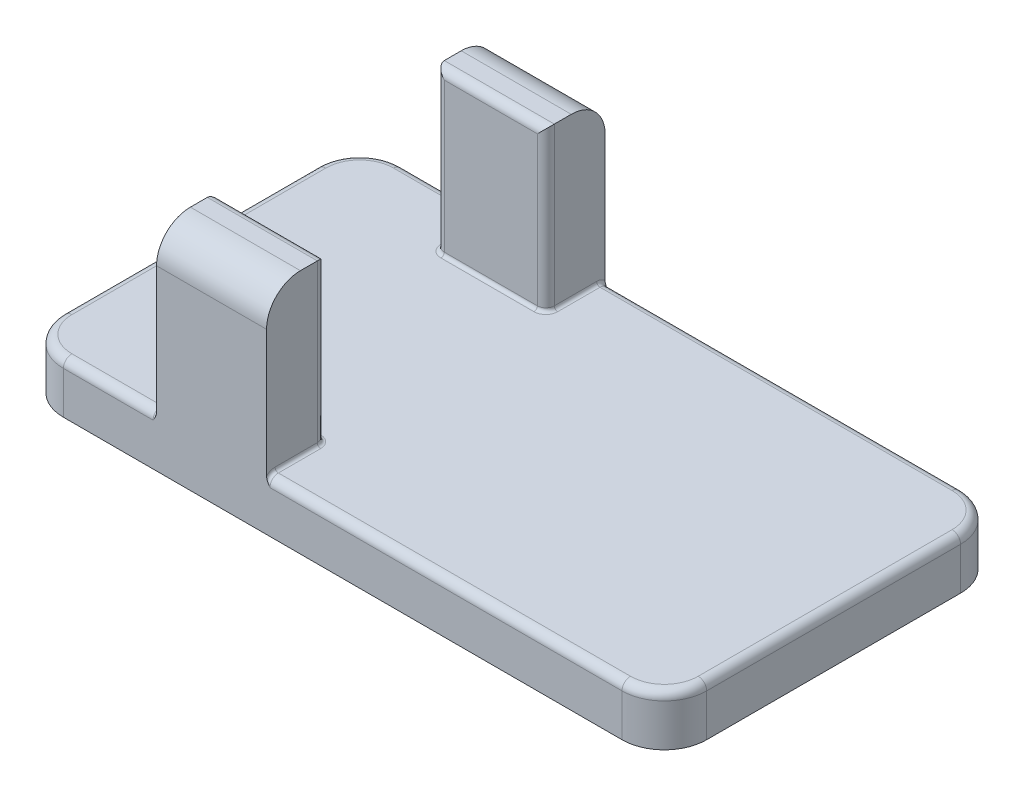
from build123d import *

# Parameters (mm, degrees)
SKETCH_1_W          = 76
SKETCH_1_H          = 40
EXTRUDE_1_DEPTH     = 6
SKETCH_2_W          = 13
SKETCH_2_H          = 40
EXTRUDE_2_DEPTH     = 19
SKETCH_3_W          = 13
SKETCH_3_H          = 26
CUT_EXTRUDE_1_DEPTH = 19
FILLET_1_R          = 4
FILLET_2_R          = 1
FILLET_3_R          = 1
FILLET_4_R          = 5
FILLET_5_R          = 1
FILLET_6_R          = 1
FILLET_7_R          = 0.4


with BuildPart() as part:
    # Эскиз1 → Бобышка-Вытянуть1 (new body)
    with BuildSketch(Plane(origin=(0, 0, 0), x_dir=(1, 0, 0), z_dir=(0, 1, 0))):
        Rectangle(SKETCH_1_W, SKETCH_1_H)
    extrude(amount=EXTRUDE_1_DEPTH)

    # Эскиз2 → Бобышка-Вытянуть2 (add)
    with BuildSketch(Plane(origin=(0, 6, 0), x_dir=(1, 0, 0), z_dir=(0, 1, 0))):
        with Locations((-15.5, 0)):
            Rectangle(SKETCH_2_W, SKETCH_2_H)
    extrude(amount=EXTRUDE_2_DEPTH)

    # Эскиз3 → Вырез-Вытянуть1 (cut)
    with BuildSketch(Plane(origin=(0, 25, 0), x_dir=(1, 0, 0), z_dir=(0, 1, 0))):
        with Locations((-15.5, 0)):
            Rectangle(SKETCH_3_W, SKETCH_3_H)
    extrude(amount=-CUT_EXTRUDE_1_DEPTH, mode=Mode.SUBTRACT)

    # Скругление1
    fillet_1_edges = [part.edges().sort_by_distance(p)[0] for p in [
        (-15.5, 25, 20),
        (-15.5, 25, -20),
    ]]
    fillet(fillet_1_edges, radius=FILLET_1_R)

    # Скругление2
    fillet_2_edges = [part.edges().sort_by_distance(p)[0] for p in [
        (-22, 15.5, -13),
        (-9, 15.5, -13),
        (-15.5, 25, -13),
    ]]
    fillet(fillet_2_edges, radius=FILLET_2_R)

    # Скругление3
    fillet_3_edges = [part.edges().sort_by_distance(p)[0] for p in [
        (-22, 15.5, 13),
        (-9, 15.5, 13),
        (-15.5, 25, 13),
    ]]
    fillet(fillet_3_edges, radius=FILLET_3_R)

    # Скругление4
    fillet_4_edges = [part.edges().sort_by_distance(p)[0] for p in [
        (38, 3, 20),
        (-38, 3, 20),
        (-38, 3, -20),
        (38, 3, -20),
    ]]
    fillet(fillet_4_edges, radius=FILLET_4_R)

    # Скругление5
    fillet_5_edges = [part.edges().sort_by_distance(p)[0] for p in [
        (-38, 6, 0),
        (-27.5, 6, 20),
        (-36.535533906, 6, 18.535533906),
        (-36.535533906, 6, -18.535533906),
        (-27.5, 6, -20),
    ]]
    fillet(fillet_5_edges, radius=FILLET_5_R)

    # Скругление6
    fillet_6_edges = [part.edges().sort_by_distance(p)[0] for p in [
        (12, 6, -20),
        (38, 6, 0),
        (36.535533906, 6, -18.535533906),
        (36.535533906, 6, 18.535533906),
        (12, 6, 20),
    ]]
    fillet(fillet_6_edges, radius=FILLET_6_R)

    # Скругление7
    # the kernel refuses this fillet: 0.4 mm, written as the material it adds along each edge
    with BuildSketch(Plane(origin=(-22, 6, -19), x_dir=(-1, 0, 0), z_dir=(0, 0, 1)), Plane(origin=(-9, 6, 19), x_dir=(1, 0, 0), z_dir=(0, 0, -1)), Plane(origin=(-9, 6, -14), x_dir=(1, 0, 0), z_dir=(0, 0, -1)), Plane(origin=(-22, 6, 14), x_dir=(-1, 0, 0), z_dir=(0, 0, 1))) as fillet_7_piece_1:
        with BuildLine():
            CenterArc((FILLET_7_R, -FILLET_7_R), FILLET_7_R, 90, 90)
            Line((0, -FILLET_7_R), (0, 0))
            Line((0, 0), (FILLET_7_R, 0))
        make_face()
    extrude(amount=5)
    with BuildSketch(Plane(origin=(-22, 5, -19), x_dir=(0, 1, 0), z_dir=(0, 0, 1))) as fillet_7_piece_2_section:
        with BuildLine():
            CenterArc((1 + FILLET_7_R, FILLET_7_R), FILLET_7_R, 180, 90)
            Line((1, FILLET_7_R), (1, 0))
            Line((1, 0), (1 + FILLET_7_R, 0))
        make_face()
    fillet_7_piece_2 = revolve(axis=Axis((-22, 5, -19), (-1, 0, 0)), revolution_arc=147.318795695, mode=Mode.PRIVATE)
    fillet_7_piece_2 = split(fillet_7_piece_2, bisect_by=Plane(origin=(-22.06536945, 6.084454663, -20), z_dir=(0, 0, 1)), keep=Keep.TOP, mode=Mode.PRIVATE)
    add(fillet_7_piece_2)
    with BuildSketch(Plane(origin=(-22, 5, 19), x_dir=(0, 1, 0), z_dir=(0, 0, -1))) as fillet_7_piece_3_section:
        with BuildLine():
            CenterArc((1 + FILLET_7_R, -FILLET_7_R), FILLET_7_R, 90, 90)
            Line((1 + FILLET_7_R, 0), (1, 0))
            Line((1, 0), (1, -FILLET_7_R))
        make_face()
    fillet_7_piece_3 = revolve(axis=Axis((-22, 5, 19), (1, 0, 0)), revolution_arc=147.318795695, mode=Mode.PRIVATE)
    fillet_7_piece_3 = split(fillet_7_piece_3, bisect_by=Plane(origin=(-22.10538555, 5.722614098, 20), z_dir=(0, 0, -1)), keep=Keep.TOP, mode=Mode.PRIVATE)
    add(fillet_7_piece_3)
    with BuildSketch(Plane(origin=(-9, 5, -19), x_dir=(0, 1, 0), z_dir=(0, 0, 1))) as fillet_7_piece_4_section:
        with BuildLine():
            CenterArc((1 + FILLET_7_R, -FILLET_7_R), FILLET_7_R, 90, 90)
            Line((1, -FILLET_7_R), (1, 0))
            Line((1, 0), (1 + FILLET_7_R, 0))
        make_face()
    fillet_7_piece_4 = revolve(axis=Axis((-9, 5, -19), (-1, 0, 0)), revolution_arc=147.318795695, mode=Mode.PRIVATE)
    fillet_7_piece_4 = split(fillet_7_piece_4, bisect_by=Plane(origin=(-8.934630555, 6.084454665, -20), z_dir=(0, 0, 1)), keep=Keep.TOP, mode=Mode.PRIVATE)
    add(fillet_7_piece_4)
    with BuildSketch(Plane(origin=(-9, 5, 19), x_dir=(0, 1, 0), z_dir=(0, 0, -1))) as fillet_7_piece_5_section:
        with BuildLine():
            CenterArc((1 + FILLET_7_R, FILLET_7_R), FILLET_7_R, 180, 90)
            Line((1 + FILLET_7_R, 0), (1, 0))
            Line((1, 0), (1, FILLET_7_R))
        make_face()
    fillet_7_piece_5 = revolve(axis=Axis((-9, 5, 19), (1, 0, 0)), revolution_arc=147.318795695, mode=Mode.PRIVATE)
    fillet_7_piece_5 = split(fillet_7_piece_5, bisect_by=Plane(origin=(-8.894614474, 5.72261425, 20), z_dir=(0, 0, -1)), keep=Keep.TOP, mode=Mode.PRIVATE)
    add(fillet_7_piece_5)
    with BuildSketch(Plane(origin=(-21, 6, -13), x_dir=(0, 0, 1), z_dir=(1, 0, 0)), Plane(origin=(-10, 6, 13), x_dir=(0, 0, -1), z_dir=(-1, 0, 0))) as fillet_7_piece_6:
        with BuildLine():
            CenterArc((FILLET_7_R, -FILLET_7_R), FILLET_7_R, 90, 90)
            Line((0, -FILLET_7_R), (0, 0))
            Line((0, 0), (FILLET_7_R, 0))
        make_face()
    extrude(amount=11)
    with BuildSketch(Plane(origin=(-10, 6, -14), x_dir=(1, 0, 0), z_dir=(0, 0, -1))) as fillet_7_piece_7:
        with BuildLine():
            CenterArc((1 + FILLET_7_R, -FILLET_7_R), FILLET_7_R, 90, 90)
            Line((1, -FILLET_7_R), (1, 0))
            Line((1, 0), (1 + FILLET_7_R, 0))
        make_face()
    revolve(axis=Axis((-10, 6, -14), (0, -1, 0)), revolution_arc=90)
    with BuildSketch(Plane(origin=(-21, 6, -14), x_dir=(0, 0, 1), z_dir=(1, 0, 0))) as fillet_7_piece_8:
        with BuildLine():
            CenterArc((1 + FILLET_7_R, -FILLET_7_R), FILLET_7_R, 90, 90)
            Line((1, -FILLET_7_R), (1, 0))
            Line((1, 0), (1 + FILLET_7_R, 0))
        make_face()
    revolve(axis=Axis((-21, 6, -14), (0, -1, 0)), revolution_arc=90)
    with BuildSketch(Plane(origin=(-10, 6, 14), x_dir=(1, 0, 0), z_dir=(0, 0, 1))) as fillet_7_piece_9:
        with BuildLine():
            CenterArc((1 + FILLET_7_R, FILLET_7_R), FILLET_7_R, 180, 90)
            Line((1, FILLET_7_R), (1, 0))
            Line((1, 0), (1 + FILLET_7_R, 0))
        make_face()
    revolve(axis=Axis((-10, 6, 14), (0, 1, 0)), revolution_arc=90)
    with BuildSketch(Plane(origin=(-21, 6, 14), x_dir=(0, 0, -1), z_dir=(1, 0, 0))) as fillet_7_piece_10:
        with BuildLine():
            CenterArc((1 + FILLET_7_R, FILLET_7_R), FILLET_7_R, 180, 90)
            Line((1, FILLET_7_R), (1, 0))
            Line((1, 0), (1 + FILLET_7_R, 0))
        make_face()
    revolve(axis=Axis((-21, 6, 14), (0, 1, 0)), revolution_arc=90)


solid = part.part
